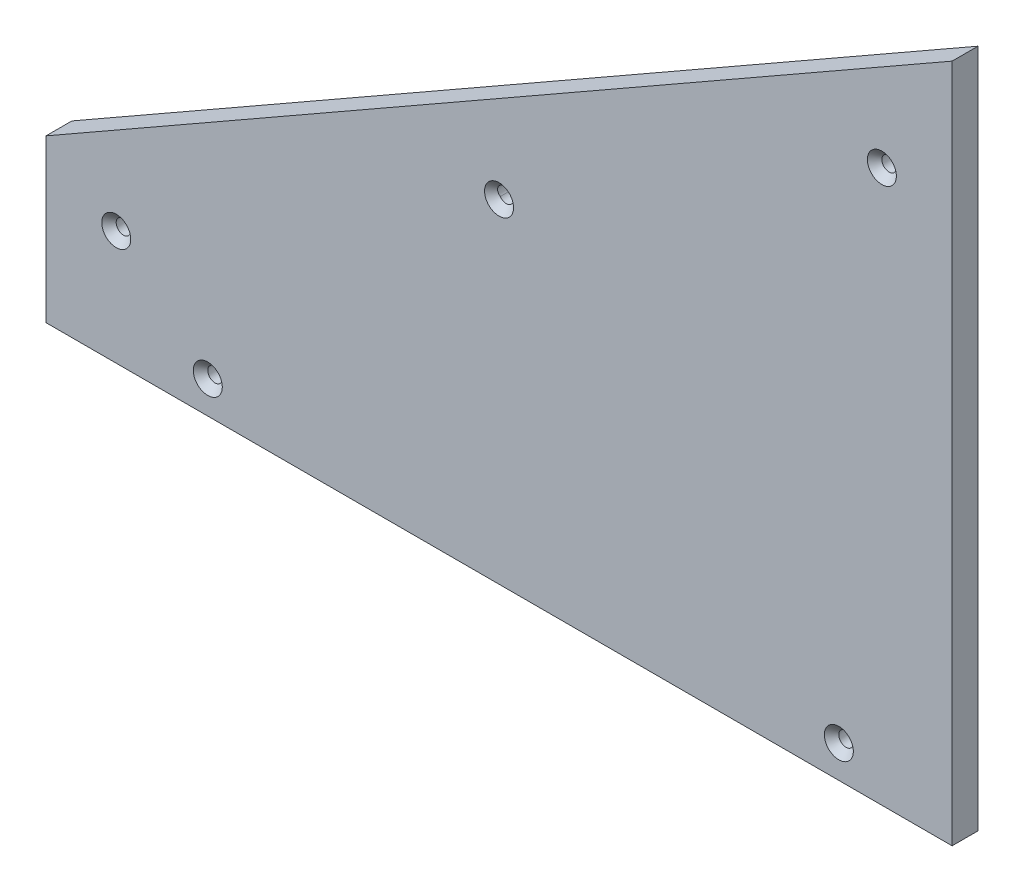
from build123d import *

# Parameters (mm, degrees)
RESSALTO_EXTRUS_O3_DEPTH                       = 8
ESCAREADO_PARA_SFHCS_M42_D                     = 4.5
ESCAREADO_PARA_SFHCS_M42_CSINK_D               = 8.96
ESCAREADO_PARA_SFHCS_M42_CSINK_ANGLE           = 90
RESSALTO_EXTRUS_O5_DEPTH                       = 8
ESCAREADO_PARA_SFHCS_M44_D                     = 4.5
ESCAREADO_PARA_SFHCS_M44_CSINK_D               = 8.96
ESCAREADO_PARA_SFHCS_M44_CSINK_ANGLE           = 90
ESCAREADO_PARA_SFHCS_M46_D                     = 4.5
ESCAREADO_PARA_SFHCS_M46_CSINK_D               = 8.96
ESCAREADO_PARA_SFHCS_M46_CSINK_ANGLE           = 90
ESCAREADO_PARA_SFHCS_M47_D                     = 4.5
ESCAREADO_PARA_SFHCS_M47_CSINK_D               = 8.96
ESCAREADO_PARA_SFHCS_M47_CSINK_ANGLE           = 90
ESCAREADO_PARA_SFHCS_M47_ON_FACE_2_D           = 4.5
ESCAREADO_PARA_SFHCS_M47_ON_FACE_2_CSINK_D     = 8.96
ESCAREADO_PARA_SFHCS_M47_ON_FACE_2_CSINK_ANGLE = 90


# Read off the part's stored shape, not the designer's step: Escareado para SFHCS M45
with BuildPart() as part:
    # Esboço1 → Ressalto-extrusão3 (new body)
    with BuildSketch(Plane.XY):
        Polygon((0, 20), (280, 170), (0, 0), align=None)
        Polygon((280, 0), (280, 170), (0, 0), align=None)
    extrude(amount=RESSALTO_EXTRUS_O3_DEPTH)

    # Escareado para SFHCS M42 (through all)
    with Locations(Plane(origin=(50, 10, 8), x_dir=(1, 0, 0), z_dir=(0, 0, 1))):
        with Locations((0, 0), (195, 0)):
            CounterSinkHole(ESCAREADO_PARA_SFHCS_M42_D / 2, ESCAREADO_PARA_SFHCS_M42_CSINK_D / 2, counter_sink_angle=ESCAREADO_PARA_SFHCS_M42_CSINK_ANGLE)

    # Esboço6 → Ressalto-extrusão5 (add, through all)
    with BuildSketch(Plane.XY.offset(8)):
        Polygon((0, 20), (0, 50), (280, 210), (280, 170), align=None)
    extrude(amount=-RESSALTO_EXTRUS_O5_DEPTH)

    # Escareado para SFHCS M44 (through all)
    with Locations(Plane(origin=(21.706078553, 35.403473459, 8), x_dir=(1, 0, 0), z_dir=(0, 0, 1))):
        with Locations((0, 0), (236.587842894, 135.193053082)):
            CounterSinkHole(ESCAREADO_PARA_SFHCS_M44_D / 2, ESCAREADO_PARA_SFHCS_M44_CSINK_D / 2, counter_sink_angle=ESCAREADO_PARA_SFHCS_M44_CSINK_ANGLE)

    # Escareado para SFHCS M45 outline → Escareado para SFHCS M45 (revolve, cut)
    with BuildSketch(Plane(origin=(245, 10, 0), x_dir=(1, 0, 0), z_dir=(0, -1, 0))):
        Polygon((4.48, 0), (2.25, 2.23), (2.25, 0), align=None)
    revolve(axis=Axis((245, 10, 0), (0, 0, 1)), mode=Mode.SUBTRACT)

    # Escareado para SFHCS M46 (through all)
    with Locations(Plane(origin=(258.293921447, 170.596526541, 0), x_dir=(-1, 0, 0), z_dir=(0, 0, -1))):
        with Locations((0, 0), (236.587842894, -135.193053082), (208.293921447, -160.596526541)):
            CounterSinkHole(ESCAREADO_PARA_SFHCS_M46_D / 2, ESCAREADO_PARA_SFHCS_M46_CSINK_D / 2, counter_sink_angle=ESCAREADO_PARA_SFHCS_M46_CSINK_ANGLE)

    # Escareado para SFHCS M47 (through all)
    with Locations(Plane(origin=(140, 103, 8), x_dir=(1, 0, 0), z_dir=(0, 0, 1))):
        with Locations((0, 0)):
            CounterSinkHole(ESCAREADO_PARA_SFHCS_M47_D / 2, ESCAREADO_PARA_SFHCS_M47_CSINK_D / 2, counter_sink_angle=ESCAREADO_PARA_SFHCS_M47_CSINK_ANGLE)

    # Escareado para SFHCS M47 on face 2 (through all)
    with Locations(Plane(origin=(139.792651332, 103.260866722, 0), x_dir=(-1, 0, 0), z_dir=(0, 0, -1))):
        with Locations((0, 0)):
            CounterSinkHole(ESCAREADO_PARA_SFHCS_M47_ON_FACE_2_D / 2, ESCAREADO_PARA_SFHCS_M47_ON_FACE_2_CSINK_D / 2, counter_sink_angle=ESCAREADO_PARA_SFHCS_M47_ON_FACE_2_CSINK_ANGLE)


solid = part.part
